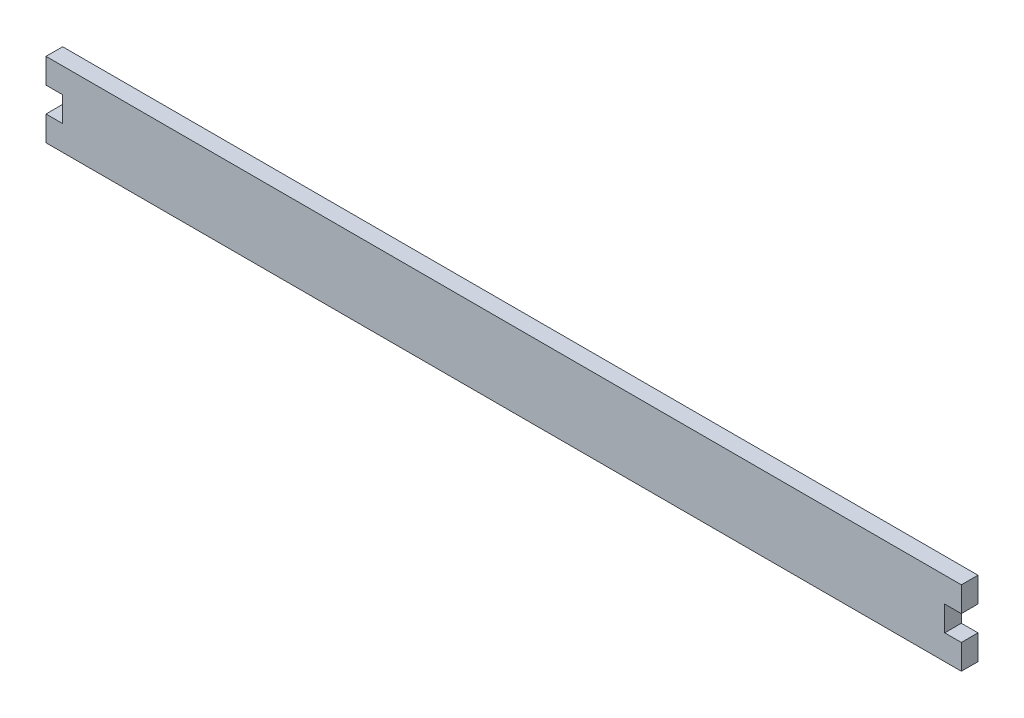
from build123d import *

# Parameters (mm, degrees)
SKETCH1_W             = 550
SKETCH1_H             = 45
EXTRUDE_356_DEPTH     = 10
CUT_EXTRUDE_571_REACH = 278.1
SKETCH2_W             = 10
SKETCH2_H             = 15


with BuildPart() as part:
    # Sketch1 → Extrude 356 (new body)
    with BuildSketch(Plane.XY):
        Rectangle(SKETCH1_W, SKETCH1_H)
    extrude(amount=EXTRUDE_356_DEPTH)

    # Sketch2 → Cut-Extrude 571 (cut, up to next)
    with BuildSketch(Plane.XY.offset(10), mode=Mode.PRIVATE) as cut_extrude_571_sk1:
        with Locations((-270, 0)):
            Rectangle(SKETCH2_W, SKETCH2_H)
    cut_extrude_571_tool1 = extrude(cut_extrude_571_sk1.sketch, amount=-CUT_EXTRUDE_571_REACH, mode=Mode.PRIVATE) & part.part
    cut_extrude_571 = cut_extrude_571_tool1.solids().sort_by_distance((-270, 0, 10))[0]
    add(cut_extrude_571, mode=Mode.SUBTRACT)

    # Mirror1: Cut-Extrude 571 across plane
    add(cut_extrude_571.mirror(Plane(origin=(0, 0, 0), x_dir=(0, 0, 1), z_dir=(1, 0, 0))), mode=Mode.SUBTRACT)


solid = part.part
